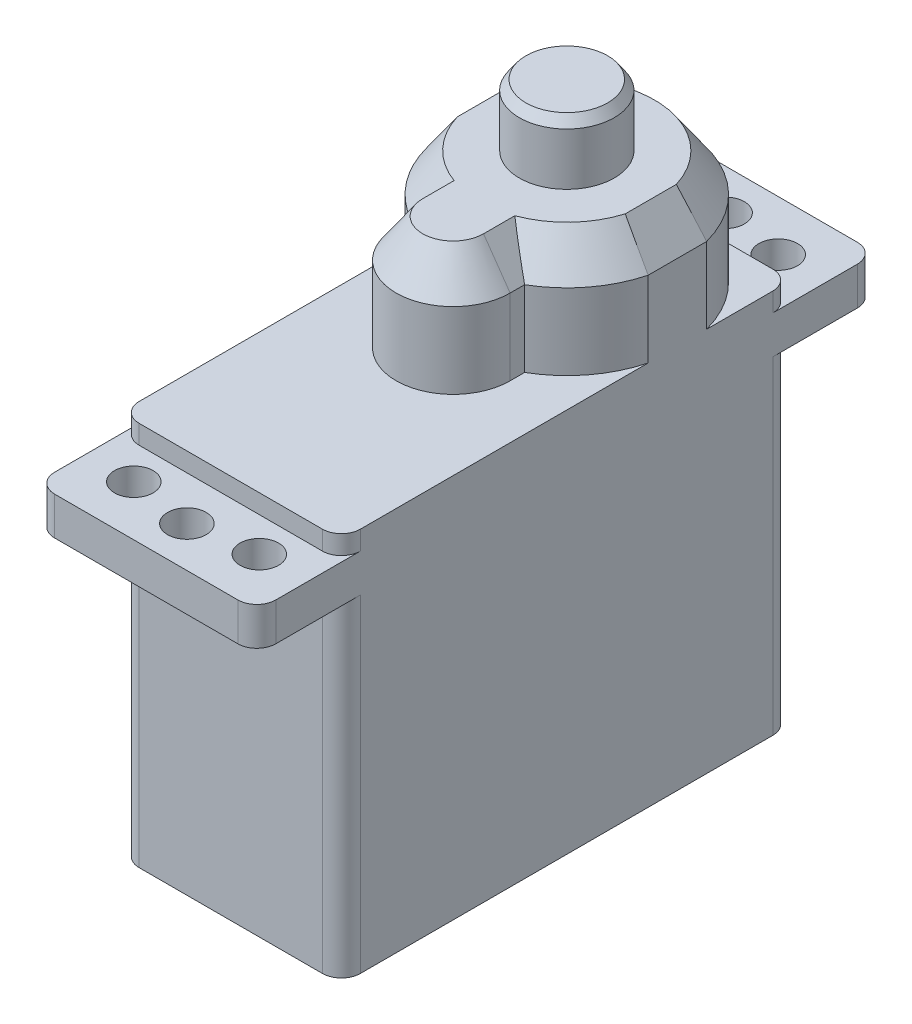
from build123d import *
from OCP.BRepFilletAPI import BRepFilletAPI_MakeChamfer

# Parameters (mm, degrees)
SKETCH1_W           = 11.64
SKETCH1_H           = 23.7
BOSS_EXTRUDE1_DEPTH = 20.25
SKETCH2_W           = 11.64
SKETCH2_H           = 2
BOSS_EXTRUDE2_DEPTH = 4.45
SKETCH3_W           = 11.64
SKETCH3_H           = 2
BOSS_EXTRUDE3_DEPTH = 4.45
FILLET1_R           = 1
BOSS_EXTRUDE4_DEPTH = 6
CHAMFER2_SIZE2      = 1.400415076
CHAMFER2_SIZE       = 2
SKETCH5_R           = 2.5
BOSS_EXTRUDE5_DEPTH = 3.25
SKETCH6_W           = 6
SKETCH6_H           = 4
SKETCH6_W_2         = 3.2
SKETCH6_H_2         = 1.2
BOSS_EXTRUDE6_DEPTH = 1.5
FILLET2_R           = 0.5
CHAMFER3_SIZE       = 0.5
CHAMFER3_SIZE2      = 0.350103769
CUT_EXTRUDE1_REACH  = 27.887
SKETCH7_R           = 1.016
FILLET3_R           = 0.5


with BuildPart() as part:
    # Sketch1 → Boss-Extrude1 (new body)
    with BuildSketch(Plane(origin=(0, 0, 0), x_dir=(1, 0, 0), z_dir=(0, 1, 0))):
        Rectangle(SKETCH1_W, SKETCH1_H)
    extrude(amount=BOSS_EXTRUDE1_DEPTH)

    # Sketch2 → Boss-Extrude2 (add)
    with BuildSketch(Plane.XY.offset(11.85)):
        with Locations((0, 18.25)):
            Rectangle(SKETCH2_W, SKETCH2_H)
    extrude(amount=BOSS_EXTRUDE2_DEPTH)

    # Sketch3 → Boss-Extrude3 (add)
    with BuildSketch(Plane(origin=(0, 0, -11.85), x_dir=(-1, 0, 0), z_dir=(0, 0, -1))):
        with Locations((0, 18.25)):
            Rectangle(SKETCH3_W, SKETCH3_H)
    extrude(amount=BOSS_EXTRUDE3_DEPTH)

    # Fillet1
    fillet1_edges = [part.edges().sort_by_distance(p)[0] for p in [
        (5.82, 8.625, 11.85),
        (-5.82, 8.625, 11.85),
        (5.82, 18.25, 16.3),
        (-5.82, 18.25, 16.3),
        (-5.82, 8.625, -11.85),
        (5.82, 8.625, -11.85),
        (-5.82, 18.25, -16.3),
        (5.82, 18.25, -16.3),
        (5.82, 19.75, 11.85),
        (-5.82, 19.75, 11.85),
        (-5.82, 19.75, -11.85),
        (5.82, 19.75, -11.85),
    ]]
    fillet(fillet1_edges, radius=FILLET1_R)

    # Sketch4 → Boss-Extrude4 (add)
    with BuildSketch(Plane(origin=(0, 20.25, 0), x_dir=(1, 0, 0), z_dir=(0, 1, 0))):
        with BuildLine():
            Line((-3, -0.15), (-3, 0.611197026))
            ThreePointArc((-3, 0.611197026), (-4.778645953, 2.169252733), (-5.82, 4.292151873))
            Line((-5.82, 4.292151873), (-5.82, 7.368248127))
            ThreePointArc((-5.82, 7.368248127), (0, 11.85), (5.82, 7.368248127))
            Line((5.82, 7.368248127), (5.82, 4.292151873))
            ThreePointArc((5.82, 4.292151873), (4.778645953, 2.169252733), (3, 0.611197026))
            Line((3, 0.611197026), (3, -0.15))
            ThreePointArc((3, -0.15), (0, -3.15), (-3, -0.15))
        make_face()
    extrude(amount=BOSS_EXTRUDE4_DEPTH)

    # Chamfer2
    chamfer2_edges = [part.edges().sort_by_distance(p)[0] for p in [
        (-5.82, 26.25, -5.8302),
    ]]
    chamfer2_side = [part.faces().sort_by_distance(p)[0] for p in [
        (-5.82, 26.221991698, -5.8302),
    ]]
    chamfer(chamfer2_edges, length=CHAMFER2_SIZE, length2=CHAMFER2_SIZE2, reference=chamfer2_side[0])
    chamfer2_2_edges = [part.edges().sort_by_distance(p)[0] for p in [
        (5.82, 26.25, -5.8302),
    ]]
    chamfer2_2_side = [part.faces().sort_by_distance(p)[0] for p in [
        (5.791991698, 26.25, -5.8302),
    ]]
    chamfer(chamfer2_2_edges, length=CHAMFER2_SIZE2, length2=CHAMFER2_SIZE, reference=chamfer2_2_side[0])
    chamfer2_3_edges = [part.edges().sort_by_distance(p)[0] for p in [
        (3.752705775, 26.25, -1.123269853),
    ]]
    chamfer2_3_side = [part.faces().sort_by_distance(p)[0] for p in [
        (3.735245575, 26.25, -1.14516977),
    ]]
    chamfer(chamfer2_3_edges, length=CHAMFER2_SIZE2, length2=CHAMFER2_SIZE, reference=chamfer2_3_side[0])
    chamfer2_4_edges = [part.edges().sort_by_distance(p)[0] for p in [
        (-3.752705775, 26.25, -1.123269853),
    ]]
    chamfer2_4_side = [part.faces().sort_by_distance(p)[0] for p in [
        (-3.735245575, 26.25, -1.14516977),
    ]]
    chamfer(chamfer2_4_edges, length=CHAMFER2_SIZE2, length2=CHAMFER2_SIZE, reference=chamfer2_4_side[0])
    chamfer2_5_edges_1 = [part.edges().sort_by_distance(p)[0] for p in [
        (3, 26.25, -0.230598513),
    ]]
    chamfer2_5_side_1 = [part.faces().sort_by_distance(p)[0] for p in [
        (2.971991698, 26.25, -0.230598513),
    ]]
    chamfer2_5_edges_2 = [part.edges().sort_by_distance(p)[0] for p in [
        (0, 26.25, 3.15),
    ]]
    chamfer2_5_side_2 = [part.faces().sort_by_distance(p)[0] for p in [
        (0, 26.25, 3.121991698),
    ]]
    chamfer2_5_edges_3 = [part.edges().sort_by_distance(p)[0] for p in [
        (-3, 26.25, -0.230598513),
    ]]
    chamfer2_5_side_3 = [part.faces().sort_by_distance(p)[0] for p in [
        (-2.971991698, 26.25, -0.230598513),
    ]]
    chamfer2_5 = BRepFilletAPI_MakeChamfer(part.part.solid().wrapped)
    for e in chamfer2_5_edges_1:
        chamfer2_5.Add(CHAMFER2_SIZE2, CHAMFER2_SIZE, e.wrapped, chamfer2_5_side_1[0].wrapped)
    for e in chamfer2_5_edges_2:
        chamfer2_5.Add(CHAMFER2_SIZE2, CHAMFER2_SIZE, e.wrapped, chamfer2_5_side_2[0].wrapped)
    for e in chamfer2_5_edges_3:
        chamfer2_5.Add(CHAMFER2_SIZE2, CHAMFER2_SIZE, e.wrapped, chamfer2_5_side_3[0].wrapped)
    add(Compound.cast(chamfer2_5.Shape()), mode=Mode.REPLACE)
    chamfer2_6_edges = [part.edges().sort_by_distance(p)[0] for p in [
        (0, 26.25, -11.85),
    ]]
    chamfer2_6_side = [part.faces().sort_by_distance(p)[0] for p in [
        (0, 26.25, -11.821991698),
    ]]
    chamfer(chamfer2_6_edges, length=CHAMFER2_SIZE2, length2=CHAMFER2_SIZE, reference=chamfer2_6_side[0])

    # Sketch5 → Boss-Extrude5 (add)
    with BuildSketch(Plane(origin=(0, 26.25, 0), x_dir=(1, 0, 0), z_dir=(0, 1, 0))):
        with Locations(Location((0, 5.8302, 0), (0, 0, 90))):
            Circle(SKETCH5_R)
    extrude(amount=BOSS_EXTRUDE5_DEPTH)

    # Sketch6 → Boss-Extrude6 (add)
    with BuildSketch(Plane(origin=(0, 0, -11.85), x_dir=(-1, 0, 0), z_dir=(0, 0, -1))):
        with Locations((0, 3)):
            Rectangle(SKETCH6_W, SKETCH6_H)
        with Locations((0, 3)):
            Rectangle(SKETCH6_W_2, SKETCH6_H_2, mode=Mode.SUBTRACT)
    extrude(amount=BOSS_EXTRUDE6_DEPTH)

    # Fillet2
    fillet2_edges = [part.edges().sort_by_distance(p)[0] for p in [
        (-3, 1, -12.6),
        (-3, 5, -12.6),
        (3, 5, -12.6),
        (3, 1, -12.6),
        (1.6, 3.6, -12.6),
        (1.6, 2.4, -12.6),
        (-1.6, 2.4, -12.6),
        (-1.6, 3.6, -12.6),
    ]]
    fillet(fillet2_edges, radius=FILLET2_R)

    # Chamfer3
    chamfer3_edges = [part.edges().sort_by_distance(p)[0] for p in [
        (0, 29.5, -3.3302),
    ]]
    chamfer3_side = [part.faces().sort_by_distance(p)[0] for p in [
        (0, 27.875, -3.3302),
    ]]
    chamfer(chamfer3_edges, length=CHAMFER3_SIZE, length2=CHAMFER3_SIZE2, reference=chamfer3_side[0])

    # Sketch7 → Cut-Extrude1 (cut, up to next)
    with BuildSketch(Plane(origin=(0, 19.25, 0), x_dir=(1, 0, 0), z_dir=(0, 1, 0)), mode=Mode.PRIVATE) as cut_extrude1_sk1:
        with Locations(Location((0, -14.1605, 0), (0, 0, 270))):
            Circle(SKETCH7_R)
    cut_extrude1_tool1 = extrude(cut_extrude1_sk1.sketch, amount=-CUT_EXTRUDE1_REACH, mode=Mode.PRIVATE) & part.part
    # Sketch7 → Cut-Extrude1 (cut, up to next)
    with BuildSketch(Plane(origin=(0, 19.25, 0), x_dir=(1, 0, 0), z_dir=(0, 1, 0)), mode=Mode.PRIVATE) as cut_extrude1_sk2:
        with Locations(Location((0, 14.1605, 0), (0, 0, 270))):
            Circle(SKETCH7_R)
    cut_extrude1_tool2 = extrude(cut_extrude1_sk2.sketch, amount=-CUT_EXTRUDE1_REACH, mode=Mode.PRIVATE) & part.part
    # Sketch7 → Cut-Extrude1 (cut, up to next)
    with BuildSketch(Plane(origin=(0, 19.25, 0), x_dir=(1, 0, 0), z_dir=(0, 1, 0)), mode=Mode.PRIVATE) as cut_extrude1_sk3:
        with Locations(Location((-3.302, 13.6525, 0), (0, 0, 270))):
            Circle(SKETCH7_R)
    cut_extrude1_tool3 = extrude(cut_extrude1_sk3.sketch, amount=-CUT_EXTRUDE1_REACH, mode=Mode.PRIVATE) & part.part
    # Sketch7 → Cut-Extrude1 (cut, up to next)
    with BuildSketch(Plane(origin=(0, 19.25, 0), x_dir=(1, 0, 0), z_dir=(0, 1, 0)), mode=Mode.PRIVATE) as cut_extrude1_sk4:
        with Locations(Location((3.302, 13.6525, 0), (0, 0, 270))):
            Circle(SKETCH7_R)
    cut_extrude1_tool4 = extrude(cut_extrude1_sk4.sketch, amount=-CUT_EXTRUDE1_REACH, mode=Mode.PRIVATE) & part.part
    # Sketch7 → Cut-Extrude1 (cut, up to next)
    with BuildSketch(Plane(origin=(0, 19.25, 0), x_dir=(1, 0, 0), z_dir=(0, 1, 0)), mode=Mode.PRIVATE) as cut_extrude1_sk5:
        with Locations(Location((-3.302, -13.6525, 0), (0, 0, 270))):
            Circle(SKETCH7_R)
    cut_extrude1_tool5 = extrude(cut_extrude1_sk5.sketch, amount=-CUT_EXTRUDE1_REACH, mode=Mode.PRIVATE) & part.part
    # Sketch7 → Cut-Extrude1 (cut, up to next)
    with BuildSketch(Plane(origin=(0, 19.25, 0), x_dir=(1, 0, 0), z_dir=(0, 1, 0)), mode=Mode.PRIVATE) as cut_extrude1_sk6:
        with Locations(Location((3.302, -13.6525, 0), (0, 0, 270))):
            Circle(SKETCH7_R)
    cut_extrude1_tool6 = extrude(cut_extrude1_sk6.sketch, amount=-CUT_EXTRUDE1_REACH, mode=Mode.PRIVATE) & part.part
    add(cut_extrude1_tool1.solids().sort_by_distance((0, 19.25, 14.1605))[0], mode=Mode.SUBTRACT)
    add(cut_extrude1_tool2.solids().sort_by_distance((0, 19.25, -14.1605))[0], mode=Mode.SUBTRACT)
    add(cut_extrude1_tool3.solids().sort_by_distance((-3.302, 19.25, -13.6525))[0], mode=Mode.SUBTRACT)
    add(cut_extrude1_tool4.solids().sort_by_distance((3.302, 19.25, -13.6525))[0], mode=Mode.SUBTRACT)
    add(cut_extrude1_tool5.solids().sort_by_distance((-3.302, 19.25, 13.6525))[0], mode=Mode.SUBTRACT)
    add(cut_extrude1_tool6.solids().sort_by_distance((3.302, 19.25, 13.6525))[0], mode=Mode.SUBTRACT)

    # Fillet3
    fillet3_edges = [part.edges().sort_by_distance(p)[0] for p in [
        (0, 1, -13.35),
        (3, 3, -13.35),
        (-3, 3, -13.35),
        (0, 5, -13.35),
        (2.853553391, 4.853553391, -13.35),
        (-2.853553391, 4.853553391, -13.35),
        (-2.853553391, 1.146446609, -13.35),
        (2.853553391, 1.146446609, -13.35),
    ]]
    fillet(fillet3_edges, radius=FILLET3_R)


solid = part.part
